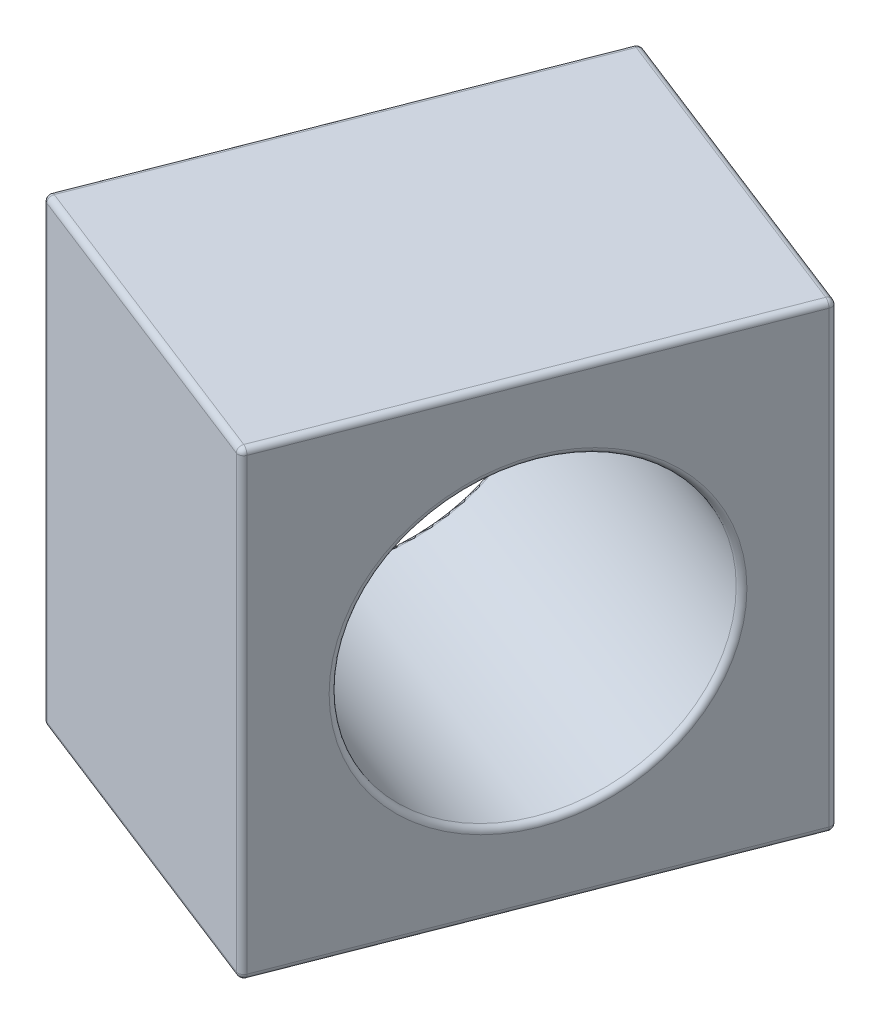
from build123d import *

# Parameters (mm, degrees)
BOSS_EXTRUDE1_DEPTH      = 20
BOSS_EXTRUDE1_DEPTH_BACK = 20
CUT_SWEEP1_PROFILE_R     = 13.5
CUT_SWEEP2_PROFILE_R     = 6
FILLET1_R                = 0.5


with BuildPart() as part:
    # Sketch20 → Boss-Extrude1 (new, two sides: drawn at the far end of the back side and taken through both)
    with BuildSketch(Plane(origin=(0, 0, 0), x_dir=(1, 0, 0), z_dir=(0, 1, 0)).offset(-BOSS_EXTRUDE1_DEPTH_BACK)):
        Polygon((271.030924973, 98.268326166), (298.972363284, 109.189682542), (284.410554783, 146.444933624), (256.469116472, 135.523577248), align=None)
    extrude(amount=BOSS_EXTRUDE1_DEPTH + BOSS_EXTRUDE1_DEPTH_BACK)

    # Cut-Sweep1: sweep along a path in Sketch6
    with BuildLine(Plane(origin=(0, 0, 0), x_dir=(1, 0, 0), z_dir=(0, 1, 0))) as cut_sweep1_path:
        Line((27.911860583, 24.714849031), (544.640102873, 226.686315947))
    # Cut-Sweep1 profile (on start of the path) → Cut-Sweep1 (sweep, cut)
    with BuildSketch(Plane(origin=(27.911860583, 0, -24.714849031), x_dir=(0.3640452125264868, 0, 0.931381277048527), z_dir=(0.931381277048527, 0, -0.3640452125264868))):
        Circle(CUT_SWEEP1_PROFILE_R)
    sweep(path=cut_sweep1_path.line, mode=Mode.SUBTRACT)

    # Cut-Sweep2: sweep along a path in Sketch19
    with BuildLine(Plane(origin=(0, 0, 0), x_dir=(1, 0, 0), z_dir=(0, 1, 0))) as cut_sweep2_path:
        Line((128.459886798, 309.266363493), (271.805005174, 137.491575647))
    # Cut-Sweep2 profile (on start of the path) → Cut-Sweep2 (sweep, cut)
    with BuildSketch(Plane(origin=(128.459886798, 0, -309.266363493), x_dir=(0.767782639292157, 0, -0.6407104016648784), z_dir=(0.6407104016648784, 0, 0.767782639292157))):
        Circle(CUT_SWEEP2_PROFILE_R)
    sweep(path=cut_sweep2_path.line, mode=Mode.SUBTRACT)

    # Fillet1
    fillet1_edges = [part.edges().sort_by_distance(p)[0] for p in [
        (291.691459034, -20, -127.817308083),
        (291.691459034, 20, -127.817308083),
        (285.001644128, -20, -103.729004354),
        (285.001644128, 20, -103.729004354),
        (298.972363284, 0, -109.189682542),
        (263.750020722, -20, -116.895951707),
        (263.750020722, 20, -116.895951707),
        (271.030924973, 0, -98.268326166),
        (258.835410353, 0, -129.469598947),
        (270.439835627, -20, -140.984255436),
        (284.410554783, 0, -146.444933624),
        (270.439835627, 20, -140.984255436),
        (256.469116472, 0, -135.523577248),
        (263.37880602, -1.3026e-05, -138.224339505),
        (286.776848665, 0, -140.390955323),
    ]]
    fillet(fillet1_edges, radius=FILLET1_R)


with BuildPart() as body_2:
    # Mirror1: mirrored copy
    add(part.part.mirror(Plane(origin=(0, 0, 0), x_dir=(0, 0, 1), z_dir=(1, 0, 0))))


solid = body_2.part
